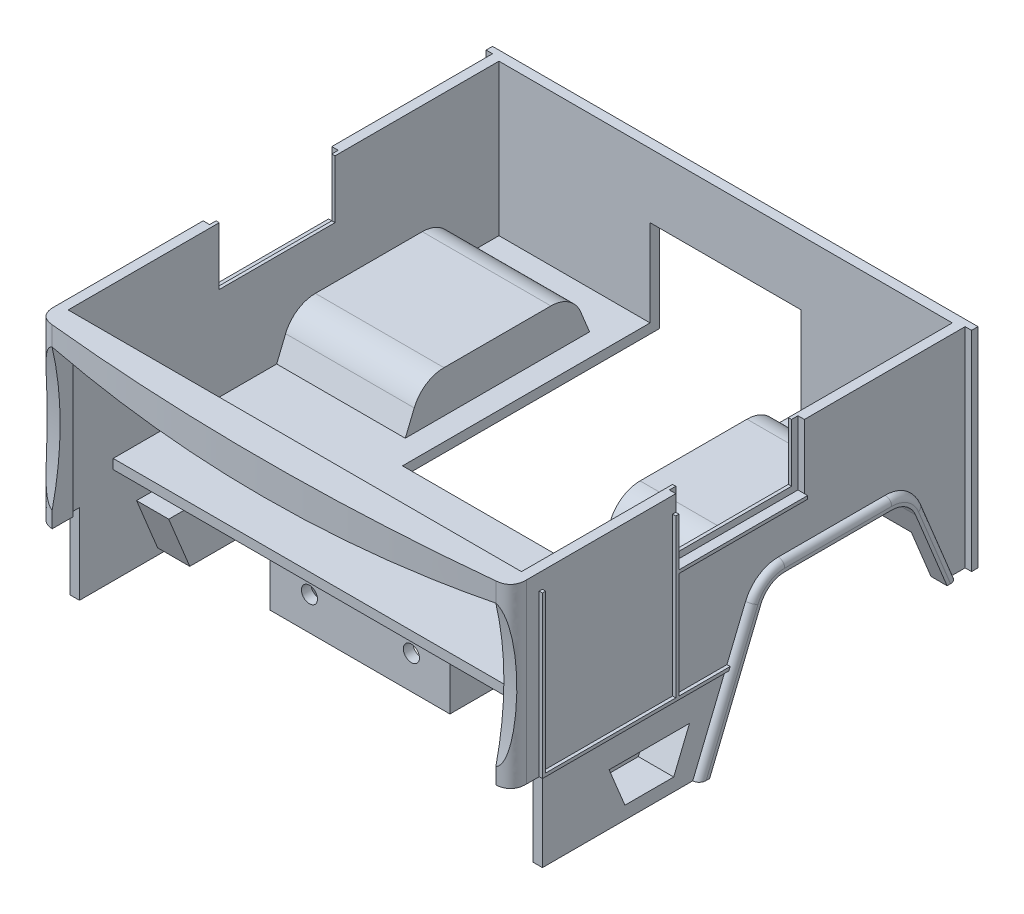
from build123d import *

# Parameters (mm, degrees)
SKETCH1_W               = 141
SKETCH1_H               = 134
BOSS_EXTRUDE1_DEPTH     = 55
CUT_EXTRUDE1_DEPTH      = 176.861451307
CUT_EXTRUDE1_DEPTH_BACK = 13
CUT_EXTRUDE2_DEPTH      = 211.318805789
BOSS_EXTRUDE2_DEPTH     = 25
SKETCH8_W               = 2
SKETCH8_H               = 80
BOSS_EXTRUDE3_DEPTH     = 2
CUT_EXTRUDE3_DEPTH      = 212.721515366
CUT_EXTRUDE3_DEPTH_BACK = 212.721515366
SKETCH9_W               = 40
SKETCH9_H               = 20
BOSS_EXTRUDE4_DEPTH     = 2
BOSS_EXTRUDE5_DEPTH     = 10
BOSS_EXTRUDE6_DEPTH     = 2
BOSS_EXTRUDE7_DEPTH     = 1
SKETCH15_W              = 141
SKETCH15_H              = 3
BOSS_EXTRUDE8_DEPTH     = 120
FILLET4_R               = 2
FILLET5_R               = 2
BOSS_EXTRUDE9_START     = 40
BOSS_EXTRUDE9_DEPTH     = 40
BOSS_EXTRUDE10_DEPTH    = 2
CUT_EXTRUDE4_DEPTH      = 38
SKETCH19_W              = 121
SKETCH19_H              = 15
CUT_EXTRUDE5_DEPTH      = 3
SKETCH20_W              = 47
SKETCH20_H              = 30
CUT_EXTRUDE6_DEPTH      = 80
BOSS_EXTRUDE11_DEPTH    = 20
SKETCH22_R              = 2.5
CUT_EXTRUDE7_DEPTH      = 20
BOSS_EXTRUDE12_DEPTH    = 1


# Some blends are built 0.0001 mm under size
with BuildPart() as part:
    # Sketch1 → Boss-Extrude1 (new body)
    with BuildSketch(Plane(origin=(0, 0, 0), x_dir=(1, 0, 0), z_dir=(0, 1, 0))):
        with BuildLine():
            Line((-73.5, 3), (-73.5, -3))
            ThreePointArc((-73.5, -3), (0, -7), (73.5, -3))
            Line((73.5, -3), (73.5, 3))
            Line((73.5, 3), (73.5, 140))
            Line((73.5, 140), (-73.5, 140))
            Line((-73.5, 140), (-73.5, 3))
        make_face()
        with Locations((0, 70)):
            Rectangle(SKETCH1_W, SKETCH1_H, mode=Mode.SUBTRACT)
    extrude(amount=BOSS_EXTRUDE1_DEPTH)

    # Fillet1
    # a fillet whose section is not a circle: 5 mm, written as the material it takes off along each edge
    with BuildSketch(Plane(origin=(73.5, -11.289002285, 3), x_dir=(0, 0, -1), z_dir=(0, 1, 0))) as fillet1_piece_1:
        with BuildLine():
            Bezier((4.498901921, 0), (-0.015132067, 0), (-0.475075473, 4.490540603), weights=[1, 1, 1])
            ThreePointArc((-0.475075473, 4.490540603), (-0.24128019, 2.24487437), (0, 0))
            Line((0, 0), (4.498901921, 0))
        make_face()
    extrude(amount=77.578004571, mode=Mode.SUBTRACT)
    with BuildSketch(Plane(origin=(-73.5, -11.289002285, 3), x_dir=(0, 0, -1), z_dir=(0, 1, 0))) as fillet1_piece_2:
        with BuildLine():
            Bezier((4.498901921, 0), (-0.015132067, 0), (-0.475075473, -4.490540603), weights=[1, 1, 1])
            ThreePointArc((-0.475075473, -4.490540603), (-0.24128019, -2.24487437), (0, 0))
            Line((0, 0), (4.498901921, 0))
        make_face()
    extrude(amount=77.578004571, mode=Mode.SUBTRACT)

    # Sketch2 → Cut-Extrude1 (cut, two sides: drawn at the far end of the back side and taken through both)
    with BuildSketch(Plane.XY.offset(10).offset(-CUT_EXTRUDE1_DEPTH_BACK)):
        with BuildLine():
            Line((-69.009459397, 49), (-69.009459397, 0))
            Line((-69.009459397, 0), (69.009459397, 0))
            Line((69.009459397, 0), (69.009459397, 49))
            ThreePointArc((69.009459397, 49), (0, 45), (-69.009459397, 49))
        make_face()
    extrude(amount=CUT_EXTRUDE1_DEPTH + CUT_EXTRUDE1_DEPTH_BACK, mode=Mode.SUBTRACT)

    # Sketch6 → Cut-Extrude2 (cut, through all)
    with BuildSketch(Plane.ZY.offset(73.5)):
        with BuildLine():
            Line((3.475075473, 49), (3.475075473, 5))
            ThreePointArc((3.475075473, 5), (0.975075473, 27), (3.475075473, 49))
        make_face()
    extrude(amount=-CUT_EXTRUDE2_DEPTH, mode=Mode.SUBTRACT)

    # Sketch7 → Boss-Extrude2 (add)
    with BuildSketch(Plane.XZ):
        Polygon((-73.5, -6.524924527), (-73.5, -140), (73.5, -140), (73.5, -6.524924527), (70.5, -6.524924527), (70.5, -137), (-70.5, -137), (-70.5, -6.524924527), align=None)
    extrude(amount=BOSS_EXTRUDE2_DEPTH)

    # Sketch8 → Boss-Extrude3 (add)
    with BuildSketch(Plane(origin=(73.5, 0, 0), x_dir=(0, 0, -1), z_dir=(1, 0, 0))):
        with Locations((139, 15)):
            Rectangle(SKETCH8_W, SKETCH8_H)
    boss_extrude3 = extrude(amount=BOSS_EXTRUDE3_DEPTH)

    # Mirror1: Boss-Extrude3 across plane
    add(boss_extrude3.mirror(Plane(origin=(0, 0, 0), x_dir=(0, 0, 1), z_dir=(1, 0, 0))))

    # Sketch9 → Cut-Extrude3 (cut, two sides: drawn at the far end of the back side and taken through both)
    with BuildSketch(Plane(origin=(73.5, 0, 0), x_dir=(0, 0, -1), z_dir=(1, 0, 0)).offset(-CUT_EXTRUDE3_DEPTH_BACK)):
        with BuildLine():
            Line((56.524924527, -25), (136.524924527, -25))
            Line((136.524924527, -25), (140, -25))
            Line((140, -25), (140, -10))
            Line((140, -10), (130.38856089, -10))
            Line((130.38856089, -10), (120.558489759, 14.029062766))
            ThreePointArc((120.558489759, 14.029062766), (117.613233858, 17.642006554), (113.154114109, 19))
            Line((113.154114109, 19), (79.895734944, 19))
            ThreePointArc((79.895734944, 19), (75.436615195, 17.642006554), (72.491359294, 14.029062766))
            Line((72.491359294, 14.029062766), (56.524924527, -25))
        make_face()
        with Locations((68, 45)):
            Rectangle(SKETCH9_W, SKETCH9_H)
        Polygon((47.35686605, -21), (32.175956959, -21), (27.265956959, -9), (52.265956959, -9), align=None)
    extrude(amount=CUT_EXTRUDE3_DEPTH + CUT_EXTRUDE3_DEPTH_BACK, mode=Mode.SUBTRACT)

    # Sketch10 → Boss-Extrude4 (add)
    with BuildSketch(Plane(origin=(73.5, 0, 0), x_dir=(0, 0, -1), z_dir=(1, 0, 0))):
        with BuildLine():
            Line((56.524924527, -25), (72.491359294, 14.029062766))
            ThreePointArc((72.491359294, 14.029062766), (75.436615195, 17.642006554), (79.895734944, 19))
            Line((79.895734944, 19), (113.154114109, 19))
            ThreePointArc((113.154114109, 19), (117.613233858, 17.642006554), (120.558489759, 14.029062766))
            Line((120.558489759, 14.029062766), (130.38856089, -10))
            Line((130.38856089, -10), (133.629887524, -10))
            Line((133.629887524, -10), (123.335130627, 15.164961303))
            ThreePointArc((123.335130627, 15.164961303), (119.285403764, 20.132759012), (113.154114109, 22))
            Line((113.154114109, 22), (79.895734944, 22))
            ThreePointArc((79.895734944, 22), (73.764445289, 20.132759012), (69.714718426, 15.164961303))
            Line((69.714718426, 15.164961303), (53.283597893, -25))
            Line((53.283597893, -25), (56.524924527, -25))
        make_face()
    boss_extrude4 = extrude(amount=BOSS_EXTRUDE4_DEPTH)

    # Mirror2: Boss-Extrude4 across plane
    add(boss_extrude4.mirror(Plane(origin=(0, 0, 0), x_dir=(0, 0, 1), z_dir=(1, 0, 0))))

    # Sketch11 → Boss-Extrude5 (add)
    with BuildSketch(Plane.ZY.offset(-70.5)):
        Polygon((-24.28668183, -7), (-55.2450232, -7), (-48.699568655, -23), (-30.833348497, -23), align=None)
        Polygon((-27.265956959, -9), (-52.265956959, -9), (-47.35686605, -21), (-32.175956959, -21), align=None, mode=Mode.SUBTRACT)
    boss_extrude5 = extrude(amount=BOSS_EXTRUDE5_DEPTH)

    # Sketch12 → Boss-Extrude6 (add)
    with BuildSketch(Plane.ZY.offset(-60.5)):
        Polygon((-27.265956959, -9), (-52.265956959, -9), (-47.35686605, -21), (-32.175956959, -21), align=None)
    boss_extrude6 = extrude(amount=-BOSS_EXTRUDE6_DEPTH)

    # Mirror3: Boss-Extrude5, Boss-Extrude6 across plane
    add(boss_extrude5.mirror(Plane(origin=(0, 0, 0), x_dir=(0, 0, 1), z_dir=(1, 0, 0))))
    add(boss_extrude6.mirror(Plane(origin=(0, 0, 0), x_dir=(0, 0, 1), z_dir=(1, 0, 0))))

    # Sketch14 → Boss-Extrude7 (add)
    with BuildSketch(Plane.ZY.offset(-70.5)):
        Polygon((-48, 35), (-48, 55), (-50, 55), (-50, 37), (-86, 37), (-86, 55), (-88, 55), (-88, 35), align=None)
    boss_extrude7 = extrude(amount=-BOSS_EXTRUDE7_DEPTH)

    # Mirror4: Boss-Extrude7 across plane
    add(boss_extrude7.mirror(Plane(origin=(0, 0, 0), x_dir=(0, 0, 1), z_dir=(1, 0, 0))))

    # Sketch15 → Boss-Extrude8 (add)
    with BuildSketch(Plane.XY.offset(-137)):
        with Locations((0, 6.5)):
            Rectangle(SKETCH15_W, SKETCH15_H)
    extrude(amount=BOSS_EXTRUDE8_DEPTH)

    # Fillet4
    fillet4_edges = [part.edges().sort_by_distance(p)[0] for p in [
        (75.5, 2.582480651, -128.482509076),
        (75.5, 20.132759012, -119.285403764),
        (75.5, 22, -96.524924527),
        (75.5, 20.132759012, -73.764445289),
        (75.5, -4.917519349, -61.499158159),
    ]]
    fillet(fillet4_edges, radius=FILLET4_R - 0.0001)  # a hair under: the kernel refuses the full size

    # Fillet5
    fillet5_edges = [part.edges().sort_by_distance(p)[0] for p in [
        (-75.5, 2.582480651, -128.482509076),
        (-75.5, -4.917519349, -61.499158159),
        (-75.5, 20.132759012, -73.764445289),
        (-75.5, 22, -96.524924527),
        (-75.5, 20.132759012, -119.285403764),
    ]]
    fillet(fillet5_edges, radius=FILLET5_R - 0.0001)  # a hair under: the kernel refuses the full size

    # Sketch16 → Boss-Extrude9 (add)
    with BuildSketch(Plane.ZY.offset(-70.5).offset(BOSS_EXTRUDE9_START)):
        with BuildLine():
            Line((-70.024924527, 8), (-72.491359294, 14.029062766))
            ThreePointArc((-72.491359294, 14.029062766), (-75.436615195, 17.642006554), (-79.895734944, 19))
            Line((-79.895734944, 19), (-113.154114109, 19))
            ThreePointArc((-113.154114109, 19), (-117.613233858, 17.642006554), (-120.558489759, 14.029062766))
            Line((-120.558489759, 14.029062766), (-123.024924527, 8))
            Line((-123.024924527, 8), (-125.185808949, 8))
            Line((-125.185808949, 8), (-122.409583671, 14.786328457))
            ThreePointArc((-122.409583671, 14.786328457), (-118.728013796, 19.302508192), (-113.154114109, 21))
            Line((-113.154114109, 21), (-79.895734944, 21))
            ThreePointArc((-79.895734944, 21), (-74.321835258, 19.302508192), (-70.640265382, 14.786328457))
            Line((-70.640265382, 14.786328457), (-67.864040104, 8))
            Line((-67.864040104, 8), (-70.024924527, 8))
        make_face()
    boss_extrude9 = extrude(amount=-BOSS_EXTRUDE9_DEPTH)

    # Sketch17 → Boss-Extrude10 (add)
    with BuildSketch(Plane.ZY.offset(-30.5)):
        with BuildLine():
            Line((-125.185808949, 8), (-67.864040104, 8))
            Line((-67.864040104, 8), (-70.640265382, 14.786328457))
            ThreePointArc((-70.640265382, 14.786328457), (-74.321835258, 19.302508192), (-79.895734944, 21))
            Line((-79.895734944, 21), (-113.154114109, 21))
            ThreePointArc((-113.154114109, 21), (-118.728013796, 19.302508192), (-122.409583671, 14.786328457))
            Line((-122.409583671, 14.786328457), (-125.185808949, 8))
        make_face()
    boss_extrude10 = extrude(amount=-BOSS_EXTRUDE10_DEPTH)

    # Sketch18 → Cut-Extrude4 (cut)
    with BuildSketch(Plane(origin=(70.5, 0, 0), x_dir=(0, 0, -1), z_dir=(1, 0, 0))):
        Polygon((68.797651799, 5), (124.252197254, 5), (123.024924527, 8), (70.024924527, 8), align=None)
    cut_extrude4 = extrude(amount=-CUT_EXTRUDE4_DEPTH, mode=Mode.SUBTRACT)

    # Mirror5: Boss-Extrude9, Boss-Extrude10, Cut-Extrude4 across plane
    add(boss_extrude9.mirror(Plane(origin=(0, 0, 0), x_dir=(0, 0, 1), z_dir=(1, 0, 0))))
    add(boss_extrude10.mirror(Plane(origin=(0, 0, 0), x_dir=(0, 0, 1), z_dir=(1, 0, 0))))
    add(cut_extrude4.mirror(Plane(origin=(0, 0, 0), x_dir=(0, 0, 1), z_dir=(1, 0, 0))), mode=Mode.SUBTRACT)

    # Sketch19 → Cut-Extrude5 (cut)
    with BuildSketch(Plane.XY.offset(-137)):
        with Locations((0, -2.5)):
            Rectangle(SKETCH19_W, SKETCH19_H)
    extrude(amount=-CUT_EXTRUDE5_DEPTH, mode=Mode.SUBTRACT)

    # Sketch20 → Cut-Extrude6 (cut)
    with BuildSketch(Plane(origin=(0, 0, -140), x_dir=(-1, 0, 0), z_dir=(0, 0, -1))):
        with Locations((0, 20)):
            Rectangle(SKETCH20_W, SKETCH20_H)
    extrude(amount=-CUT_EXTRUDE6_DEPTH, mode=Mode.SUBTRACT)

    # Sketch21 → Boss-Extrude11 (add)
    with BuildSketch(Plane.XZ.offset(-5)):
        Polygon((-28.271537794, -23.524924527), (27.728462206, -23.524924527), (27.728462206, -53.524924527), (24.09909061, -53.524924527), (24.09909061, -26.524924527), (-24.559460198, -26.524924527), (-24.559460198, -53.524924527), (-28.271537794, -53.524924527), align=None)
    extrude(amount=BOSS_EXTRUDE11_DEPTH)

    # Sketch22 → Cut-Extrude7 (cut)
    with BuildSketch(Plane(origin=(0, 0, -26.524924527), x_dir=(-1, 0, 0), z_dir=(0, 0, -1))):
        with Locations((-15.737886106, -4.65)):
            Circle(SKETCH22_R)
        with Locations((15.962113894, -4.65)):
            Circle(SKETCH22_R)
    extrude(amount=-CUT_EXTRUDE7_DEPTH, mode=Mode.SUBTRACT)

    # Sketch23 → Boss-Extrude12 (add)
    with BuildSketch(Plane(origin=(73.5, 0, 0), x_dir=(0, 0, -1), z_dir=(1, 0, 0))):
        Polygon((6.524924527, 0), (5.524924527, 0), (5.524924527, 50), (6.524924527, 50), (6.524924527, 1), (47, 1), (47, 50), (48, 50), (48, 35), (88, 35), (88, 34), (48, 34), (48, 1), (63.919961529, 1), (63.51087062, 0), align=None)
    boss_extrude12 = extrude(amount=BOSS_EXTRUDE12_DEPTH)

    # Mirror6: Boss-Extrude12 across plane
    add(boss_extrude12.mirror(Plane(origin=(0, 0, 0), x_dir=(0, 0, 1), z_dir=(1, 0, 0))))


solid = part.part
